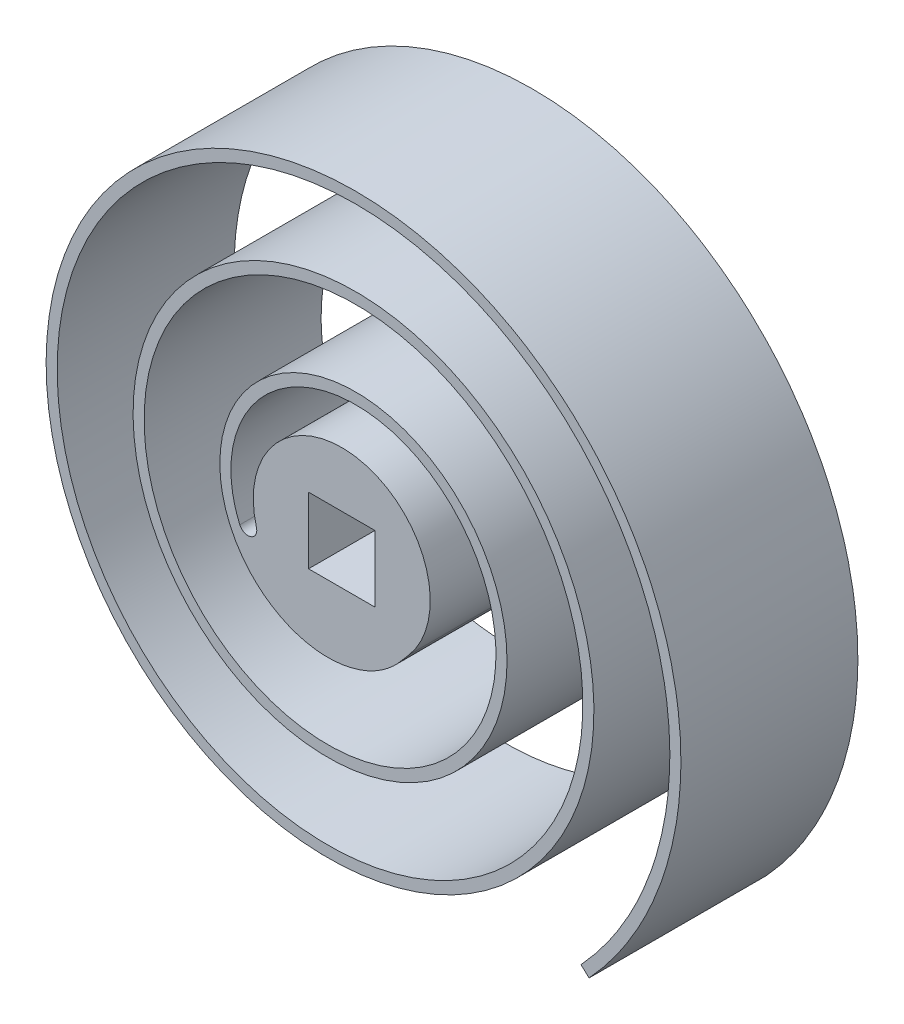
from build123d import *

# Parameters (mm, degrees)
BOSS_EXTRUDE1_OUTLINE_W = 19.05
BOSS_EXTRUDE1_OUTLINE_H = 19.05
BOSS_EXTRUDE1_DEPTH     = 50.8
FILLET1_R               = 2.54


# Read off the part's stored shape, not the designer's step: Boss-Extrude1
with BuildPart() as part:
    # Boss-Extrude1 outline → Boss-Extrude1 (new body)
    with BuildSketch(Plane.XY):
        with BuildLine():
            Line((68.66131522, -68.839120389), (70.993520912, -70.993520912))
            add(Edge.make_bspline(
                [(70.993520912, -70.993520912), (74.340300427, -67.37052781), (77.409588242, -63.510919928), (82.933225435, -55.407415426), (85.387541386, -51.163589541), (89.63524573, -42.388039218), (91.428611647, -37.856389258), (94.323320997, -28.606714987), (95.424653276, -23.888767221), (96.919600243, -14.370883598), (97.313215219, -9.571024652), (97.39259548, 0.005741541), (97.078372357, 4.782573201), (95.757328365, 14.21008558), (94.750530008, 18.860693679), (92.074458218, 27.93652971), (90.4052176, 32.36168955), (86.448422108, 40.893486572), (84.160909513, 45.00006163), (79.024639123, 52.809592133), (76.175932033, 56.512492714), (69.985850915, 63.43938258), (66.644534807, 66.663325384), (59.547688814, 72.568337642), (55.792222707, 75.24936992), (47.953573796, 80.017186979), (43.870459161, 82.103944595), (35.469069061, 85.645393762), (31.150864608, 87.100068636), (22.375815657, 89.35374859), (17.919043419, 90.152747725), (8.96518926, 91.086027336), (4.468179244, 91.2203126), (-4.468179244, 90.829687599), (-8.907457743, 90.304792621), (-17.632875386, 88.615599991), (-21.918948003, 87.45132766), (-30.247022836, 84.516831735), (-34.288963391, 82.74664282), (-42.044318076, 78.64652081), (-45.757676709, 76.316630874), (-52.779648852, 71.154898398), (-56.088214172, 68.323106443), (-62.234177935, 62.225535569), (-65.071536465, 58.959813454), (-70.219786966, 52.070906268), (-72.530648077, 48.447782895), (-76.58279053, 40.927372709), (-78.324050631, 37.030151068), (-81.206847817, 29.049710687), (-82.348373626, 24.966559113), (-84.015017822, 16.705301098), (-84.54013502, 12.527262316), (-84.970923636, 4.168119736), (-84.87660385, -0.012917409), (-84.079011455, -8.287339721), (-83.375757305, -12.380660699), (-81.383910162, -20.392074806), (-80.095344758, -24.310107592), (-76.968917106, -31.888383918), (-75.131090851, -35.548572239), (-70.953654734, -42.535351069), (-68.614088367, -45.861892634), (-63.490960489, -52.113889015), (-60.707448915, -55.039302161), (-54.763088574, -60.431235328), (-51.602294998, -62.897721777), (-44.977316404, -67.324809423), (-41.513190545, -69.285385778), (-34.361060556, -72.665353875), (-30.673118192, -74.084729936), (-23.156616532, -76.35930021), (-19.32812021, -77.214488125), (-11.615643523, -78.350317324), (-7.731725931, -78.630961708), (0.00648061, -78.620019326), (3.86070837, -78.328444858), (11.456307644, -77.187828558), (15.197620883, -76.338807826), (22.487845745, -74.11000835), (26.036703255, -72.730258919), (32.867844131, -69.477898268), (36.150078689, -67.605323811), (42.380722138, -63.415401901), (45.32908853, -61.098097743), (50.833038572, -56.075793159), (53.388586884, -53.370841509), (58.057408898, -47.637921267), (60.170655105, -44.610005775), (63.915791286, -38.301906959), (65.547662104, -35.021779821), (68.30207771, -28.284432373), (69.424611985, -24.827270046), (71.143942597, -17.813734806), (71.740737172, -14.25742036), (72.403918708, -7.124419519), (72.470312572, -3.54779077), (72.079687571, 3.54779077), (71.622683994, 7.066688001), (70.203589438, 13.971252327), (69.241521667, 17.356867152), (66.841375084, 23.923428273), (65.403326768, 27.104326703), (62.090238318, 33.195638736), (60.21523518, 36.106009872), (56.076183583, 41.597431919), (53.8121777, 44.178446625), (48.950797069, 48.960484636), (46.353469447, 51.161478709), (40.887502084, 55.141952676), (38.0189129, 56.921410856), (32.077389767, 60.027204828), (29.004508627, 61.35352679), (22.724724392, 63.531889135), (19.517875148, 64.383923758), (13.042228303, 65.60329564), (9.773484379, 65.970635213), (3.246254904, 66.220996136), (-0.01217834, 66.104027695), (-6.448041, 65.396757944), (-9.625420623, 64.806474385), (-15.831427795, 63.17374501), (-18.860009136, 62.131323971), (-24.705112851, 59.625035395), (-27.521593577, 58.161198996), (-32.884952073, 54.851499126), (-35.431793612, 53.005672355), (-40.205264084, 48.979094025), (-42.431862925, 46.798383816), (-46.522170229, 42.155649338), (-48.385855313, 39.693670067), (-51.716393411, 34.547217382), (-53.183230169, 31.862791549), (-55.69546202, 26.334081894), (-56.740848226, 23.489847126), (-58.395279423, 17.706518077), (-59.004322973, 14.767473199), (-59.781034405, 8.860403447), (-59.948708198, 5.89242721), (-59.847443171, -0.007219679), (-59.578517358, -2.938843538), (-58.618328751, -8.702529708), (-57.927085644, -11.534548088), (-56.145558482, -17.03916178), (-55.055300238, -19.711716961), (-52.507374427, -24.842201691), (-51.049738109, -27.300095747), (-47.80616468, -31.951852143), (-46.020263454, -34.145684345), (-42.165735403, -38.226694565), (-40.097148211, -40.113848384), (-35.72815372, -43.546480155), (-33.427788842, -45.091940289), (-28.650240121, -47.814395592), (-26.173100481, -48.991379612), (-21.099795685, -50.958761658), (-18.503675484, -51.749155334), (-13.251653955, -52.934136603), (-10.595797301, -53.32872662), (-5.283649777, -53.721810081), (-2.627402296, -53.720312543), (2.627402296, -53.329687542), (5.22591826, -52.940575366), (10.309629268, -51.791578886), (12.794786301, -51.031715673), (17.599833711, -49.165918433), (19.919690015, -48.060010716), (24.346959396, -45.533955826), (26.454343035, -44.113839487), (30.415214986, -40.997468768), (32.268679079, -39.301248957), (35.686791338, -35.676058569), (37.251420953, -33.747125439), (40.064118387, -29.704097899), (41.312173634, -27.590042905), (43.471619125, -23.227406825), (44.38300295, -20.978866186), (46.593894206, -14.110174053), (47.36616879, -9.367364629), (47.506035252, 0.023268113), (46.87399727, 4.669880429), (44.326774054, 13.471080902), (42.412288953, 17.624645834), (37.528361706, 25.104522159), (34.559873025, 28.430082968), (27.877655794, 34.007445852), (24.165037214, 36.258826759), (16.354458571, 39.547817967), (12.257657597, 40.585360989), (4.054331963, 41.420548318), (-0.051092173, 41.218470316), (-7.914638305, 39.658948486), (-11.671816375, 38.302087041), (-18.531473541, 34.615105102), (-21.633244963, 32.285804923), (-26.949385755, 26.912301888), (-29.163338261, 23.869071222), (-32.562887112, 17.375073972), (-33.748382719, 13.92533483), (-35.049646574, 6.944319194), (-35.165625015, 3.414027643), (-34.384375014, -3.414027643), (-33.487633629, -6.710938599), (-30.824737833, -12.798005999), (-29.059288714, -15.587515269), (-24.871909032, -20.448158982), (-22.450825289, -22.518902748), (-17.210649857, -25.808744547), (-14.392459716, -27.027732778), (-8.635515832, -28.566718104), (-5.697630141, -28.886882829), (0.029176393, -28.665893906), (2.817343821, -28.125155467), (8.007730423, -26.296167787), (10.409377338, -25.008528974), (14.096931119, -22.265793697), (15.510679215, -20.939789846), (16.743208953, -19.499824329)],
                knots=[0, 0, 0, 0, 0.0078125, 0.0078125, 0.015625, 0.015625, 0.0234375, 0.0234375, 0.03125, 0.03125, 0.0390625, 0.0390625, 0.046875, 0.046875, 0.0546875, 0.0546875, 0.0625, 0.0625, 0.0703125, 0.0703125, 0.078125, 0.078125, 0.0859375, 0.0859375, 0.09375, 0.09375, 0.1015625, 0.1015625, 0.109375, 0.109375, 0.1171875, 0.1171875, 0.125, 0.125, 0.1328125, 0.1328125, 0.140625, 0.140625, 0.1484375, 0.1484375, 0.15625, 0.15625, 0.1640625, 0.1640625, 0.171875, 0.171875, 0.1796875, 0.1796875, 0.1875, 0.1875, 0.1953125, 0.1953125, 0.203125, 0.203125, 0.2109375, 0.2109375, 0.21875, 0.21875, 0.2265625, 0.2265625, 0.234375, 0.234375, 0.2421875, 0.2421875, 0.25, 0.25, 0.2578125, 0.2578125, 0.265625, 0.265625, 0.2734375, 0.2734375, 0.28125, 0.28125, 0.2890625, 0.2890625, 0.296875, 0.296875, 0.3046875, 0.3046875, 0.3125, 0.3125, 0.3203125, 0.3203125, 0.328125, 0.328125, 0.3359375, 0.3359375, 0.34375, 0.34375, 0.3515625, 0.3515625, 0.359375, 0.359375, 0.3671875, 0.3671875, 0.375, 0.375, 0.3828125, 0.3828125, 0.390625, 0.390625, 0.3984375, 0.3984375, 0.40625, 0.40625, 0.4140625, 0.4140625, 0.421875, 0.421875, 0.4296875, 0.4296875, 0.4375, 0.4375, 0.4453125, 0.4453125, 0.453125, 0.453125, 0.4609375, 0.4609375, 0.46875, 0.46875, 0.4765625, 0.4765625, 0.484375, 0.484375, 0.4921875, 0.4921875, 0.5, 0.5, 0.5078125, 0.5078125, 0.515625, 0.515625, 0.5234375, 0.5234375, 0.53125, 0.53125, 0.5390625, 0.5390625, 0.546875, 0.546875, 0.5546875, 0.5546875, 0.5625, 0.5625, 0.5703125, 0.5703125, 0.578125, 0.578125, 0.5859375, 0.5859375, 0.59375, 0.59375, 0.6015625, 0.6015625, 0.609375, 0.609375, 0.6171875, 0.6171875, 0.625, 0.625, 0.6328125, 0.6328125, 0.640625, 0.640625, 0.6484375, 0.6484375, 0.65625, 0.65625, 0.6640625, 0.6640625, 0.671875, 0.671875, 0.6796875, 0.6796875, 0.6875, 0.6875, 0.703125, 0.703125, 0.71875, 0.71875, 0.734375, 0.734375, 0.75, 0.75, 0.765625, 0.765625, 0.78125, 0.78125, 0.796875, 0.796875, 0.8125, 0.8125, 0.828125, 0.828125, 0.84375, 0.84375, 0.859375, 0.859375, 0.875, 0.875, 0.890625, 0.890625, 0.90625, 0.90625, 0.921875, 0.921875, 0.9375, 0.9375, 0.953125, 0.953125, 0.96875, 0.96875, 0.984375, 0.984375, 0.99597303, 0.99597303, 0.99597303, 0.99597303], degree=3))
            Line((16.743208953, -19.499824329), (19.296544615, -16.516760152))
            ThreePointArc((19.296544615, -16.516760152), (-10.374229168, 23.184809018), (-0.543152185, -25.394191968))
            add(Edge.make_bspline(
                [(-0.543152185, -25.394191968), (-1.338325306, -25.501924799), (-2.144111456, -25.572394819), (-5.500298267, -25.701905063), (-8.124254152, -25.416901081), (-13.263783148, -24.042967294), (-15.792764131, -22.950059596), (-20.492352096, -19.999604764), (-22.674507888, -18.134357247), (-26.445751422, -13.756757755), (-28.043542253, -11.233718519), (-30.451161279, -5.730183868), (-31.266124245, -2.736997032), (-31.975037262, 3.458839474), (-31.870152798, 6.675043461), (-30.685398258, 13.03101035), (-29.602674378, 16.183991302), (-26.497784283, 22.115115879), (-24.469044951, 24.90498832), (-19.599427994, 29.827149437), (-16.748877037, 31.968669586), (-10.448102114, 35.355259146), (-6.985985111, 36.606284378), (0.255546537, 38.042446447), (4.048011352, 38.229779104), (11.620804284, 37.458786828), (15.414189026, 36.498745479), (22.640937001, 33.455602117), (26.08622492, 31.36706053), (32.282324419, 26.195439469), (35.042900809, 23.10370743), (39.580792552, 16.153794523), (41.364882933, 12.284531767), (43.736214115, 4.091075853), (44.326677888, -0.24564195), (44.196230375, -9.003886547), (43.475286335, -13.436585015), (41.408866806, -19.856439235), (40.556416075, -21.959766652), (38.536396952, -26.040725555), (37.368060149, -28.019882041), (34.734825773, -31.804945794), (33.268943918, -33.612246605), (30.066381866, -37.008828193), (28.328523478, -38.59934082), (24.614552211, -41.521452782), (22.637093376, -42.854095632), (18.482655628, -45.224481729), (16.304192747, -46.263057681), (11.791924608, -48.015168893), (9.456530073, -48.729308223), (4.679130133, -49.809073715), (2.235465076, -50.175062515), (-2.706204475, -50.54241008), (-5.205902594, -50.543882546), (-10.204944135, -50.173968017), (-12.705978081, -49.80244373), (-17.651771112, -48.68655491), (-20.098180689, -47.941805515), (-24.878828741, -46.087913126), (-27.214641687, -44.978146516), (-31.719499471, -42.411082383), (-33.890008492, -40.952936499), (-38.012232308, -37.714187522), (-39.965269196, -35.932530209), (-43.604332017, -32.079645404), (-45.29150931, -30.007181173), (-48.355621717, -25.612798004), (-49.733512588, -23.289487087), (-52.141891842, -18.439992279), (-53.173119813, -15.912291789), (-54.858051822, -10.706140571), (-55.512263459, -8.026081906), (-56.420906219, -2.571807956), (-56.675602216, 0.204071384), (-56.771484375, 5.790115248), (-56.612687258, 8.601963562), (-55.876861674, 14.198087005), (-55.299601762, 16.9840289), (-53.731421195, 22.465855067), (-52.740026324, 25.16335275), (-50.357516559, 30.406580895), (-48.965695353, 32.953836302), (-45.80550989, 37.837054713), (-44.036222943, 40.174421065), (-40.153172776, 44.58190675), (-38.038290892, 46.653277401), (-33.504452544, 50.477718203), (-31.084206086, 52.231860567), (-25.987620844, 55.376936088), (-23.309849075, 56.768739214), (-17.752835951, 59.151499074), (-14.872050034, 60.143104833), (-8.969164253, 61.696086444), (-5.945442048, 62.257876513), (0.178880515, 62.930909535), (3.281145546, 63.042323166), (9.495209665, 62.803974134), (12.608679438, 62.454135192), (18.776362392, 61.292753271), (21.832215871, 60.480889019), (27.815948968, 58.405222345), (30.745402806, 57.140860946), (36.409237275, 54.180222308), (39.145091842, 52.483160848), (44.357780811, 48.687131461), (46.835956885, 46.587171409), (51.47398372, 42.024841835), (53.635014828, 39.561294129), (57.585498223, 34.320051999), (59.375944017, 31.541019198), (62.539351926, 25.724903826), (63.913099293, 22.686352004), (66.205707111, 16.41400619), (67.1251277, 13.178644203), (68.481160895, 6.580903138), (68.918096581, 3.216891559), (69.291504242, -3.56594237), (69.228055468, -6.986426125), (68.593868807, -13.807565953), (68.022964882, -17.209876146), (66.378203447, -23.919226988), (65.303938488, -27.227878485), (62.668036551, -33.675339481), (61.105759837, -36.815681553), (57.520495892, -42.854500479), (55.496650802, -45.754398369), (51.025574109, -51.24450401), (48.577285417, -53.835990461), (43.304644854, -58.647227239), (40.479059865, -60.868086263), (34.508251665, -64.883276717), (31.361646311, -66.678522897), (24.813208421, -69.796286402), (21.40987493, -71.119504832), (14.419066368, -73.256765446), (10.830004294, -74.071280057), (3.544017818, -75.165402408), (-0.154545033, -75.445243853), (-7.579679638, -75.45574353), (-11.30790561, -75.1863919), (-18.710662554, -74.096175639), (-22.386827527, -73.275058034), (-29.603698787, -71.091158984), (-33.145983349, -69.727887189), (-40.015088768, -66.481671417), (-43.343397915, -64.598010606), (-49.708111951, -60.344842617), (-52.745882874, -57.974407923), (-58.458396821, -52.792774971), (-61.134354045, -49.980458878), (-66.059092916, -43.970566029), (-68.308910679, -40.771705599), (-72.325726058, -34.053565604), (-74.093559353, -30.532864582), (-77.100623528, -23.243918288), (-78.340471674, -19.4741448), (-80.25680404, -11.766458893), (-80.9336739, -7.826944812), (-81.701237972, 0.135956196), (-81.792078029, 4.160983354), (-81.377396219, 12.207584991), (-80.871777452, 16.230802593), (-79.26702089, 24.18529464), (-78.167545779, 28.118179392), (-75.391067693, 35.804296868), (-73.71349453, 39.559072121), (-69.809787739, 46.803999134), (-67.582863647, 50.295592191), (-62.62193542, 56.933842235), (-59.886937917, 60.081808064), (-53.963108411, 65.958993751), (-50.773101897, 68.689361679), (-44.003245383, 73.665768237), (-40.422065403, 75.912769364), (-32.943326228, 79.866649533), (-29.044310612, 81.574284753), (-21.011338017, 84.404797905), (-16.875829922, 85.528209448), (-8.457587164, 87.157934719), (-4.173240464, 87.664548094), (4.450546079, 88.041509988), (8.791623814, 87.911917883), (17.434300994, 87.011072923), (21.73752859, 86.239638087), (30.209556428, 84.063782497), (34.379939726, 82.658942565), (42.493047492, 79.239013435), (46.437275582, 77.223277165), (54.008642905, 72.618032729), (57.637173738, 70.02766384), (64.493543941, 64.322742227), (67.722632763, 61.207133999), (73.704266016, 54.513503662), (76.457890738, 50.934254351), (81.42226706, 43.386083138), (83.633906472, 39.415789124), (87.459093117, 31.167772239), (89.073316568, 26.88856226), (91.660920794, 18.112761939), (92.634751684, 13.614601875), (93.912388196, 4.4968631), (94.216408239, -0.124333801), (94.139620586, -9.388316999), (93.758787154, -14.032734781), (92.312373816, -23.241619196), (91.246528772, -27.807695179), (88.445237355, -36.75886437), (86.709292391, -41.145509875), (82.597858996, -49.639531055), (80.22164953, -53.748368323), (74.874174675, -61.593432189), (71.901985197, -65.330994169), (68.66131522, -68.839120389)],
                knots=[0.041883743, 0.041883743, 0.041883743, 0.041883743, 0.046875, 0.046875, 0.0625, 0.0625, 0.078125, 0.078125, 0.09375, 0.09375, 0.109375, 0.109375, 0.125, 0.125, 0.140625, 0.140625, 0.15625, 0.15625, 0.171875, 0.171875, 0.1875, 0.1875, 0.203125, 0.203125, 0.21875, 0.21875, 0.234375, 0.234375, 0.25, 0.25, 0.265625, 0.265625, 0.28125, 0.28125, 0.296875, 0.296875, 0.3125, 0.3125, 0.3203125, 0.3203125, 0.328125, 0.328125, 0.3359375, 0.3359375, 0.34375, 0.34375, 0.3515625, 0.3515625, 0.359375, 0.359375, 0.3671875, 0.3671875, 0.375, 0.375, 0.3828125, 0.3828125, 0.390625, 0.390625, 0.3984375, 0.3984375, 0.40625, 0.40625, 0.4140625, 0.4140625, 0.421875, 0.421875, 0.4296875, 0.4296875, 0.4375, 0.4375, 0.4453125, 0.4453125, 0.453125, 0.453125, 0.4609375, 0.4609375, 0.46875, 0.46875, 0.4765625, 0.4765625, 0.484375, 0.484375, 0.4921875, 0.4921875, 0.5, 0.5, 0.5078125, 0.5078125, 0.515625, 0.515625, 0.5234375, 0.5234375, 0.53125, 0.53125, 0.5390625, 0.5390625, 0.546875, 0.546875, 0.5546875, 0.5546875, 0.5625, 0.5625, 0.5703125, 0.5703125, 0.578125, 0.578125, 0.5859375, 0.5859375, 0.59375, 0.59375, 0.6015625, 0.6015625, 0.609375, 0.609375, 0.6171875, 0.6171875, 0.625, 0.625, 0.6328125, 0.6328125, 0.640625, 0.640625, 0.6484375, 0.6484375, 0.65625, 0.65625, 0.6640625, 0.6640625, 0.671875, 0.671875, 0.6796875, 0.6796875, 0.6875, 0.6875, 0.6953125, 0.6953125, 0.703125, 0.703125, 0.7109375, 0.7109375, 0.71875, 0.71875, 0.7265625, 0.7265625, 0.734375, 0.734375, 0.7421875, 0.7421875, 0.75, 0.75, 0.7578125, 0.7578125, 0.765625, 0.765625, 0.7734375, 0.7734375, 0.78125, 0.78125, 0.7890625, 0.7890625, 0.796875, 0.796875, 0.8046875, 0.8046875, 0.8125, 0.8125, 0.8203125, 0.8203125, 0.828125, 0.828125, 0.8359375, 0.8359375, 0.84375, 0.84375, 0.8515625, 0.8515625, 0.859375, 0.859375, 0.8671875, 0.8671875, 0.875, 0.875, 0.8828125, 0.8828125, 0.890625, 0.890625, 0.8984375, 0.8984375, 0.90625, 0.90625, 0.9140625, 0.9140625, 0.921875, 0.921875, 0.9296875, 0.9296875, 0.9375, 0.9375, 0.9453125, 0.9453125, 0.953125, 0.953125, 0.9609375, 0.9609375, 0.96875, 0.96875, 0.9765625, 0.9765625, 0.984375, 0.984375, 0.9921875, 0.9921875, 1, 1, 1, 1], degree=3))
        make_face()
        Rectangle(BOSS_EXTRUDE1_OUTLINE_W, BOSS_EXTRUDE1_OUTLINE_H, mode=Mode.SUBTRACT)
    extrude(amount=BOSS_EXTRUDE1_DEPTH)

    # Fillet1
    fillet1_edges = [part.edges().sort_by_distance(p)[0] for p in [
        (-0.543152185, -25.394191968, 25.4),
    ]]
    fillet(fillet1_edges, radius=FILLET1_R)


solid = part.part
